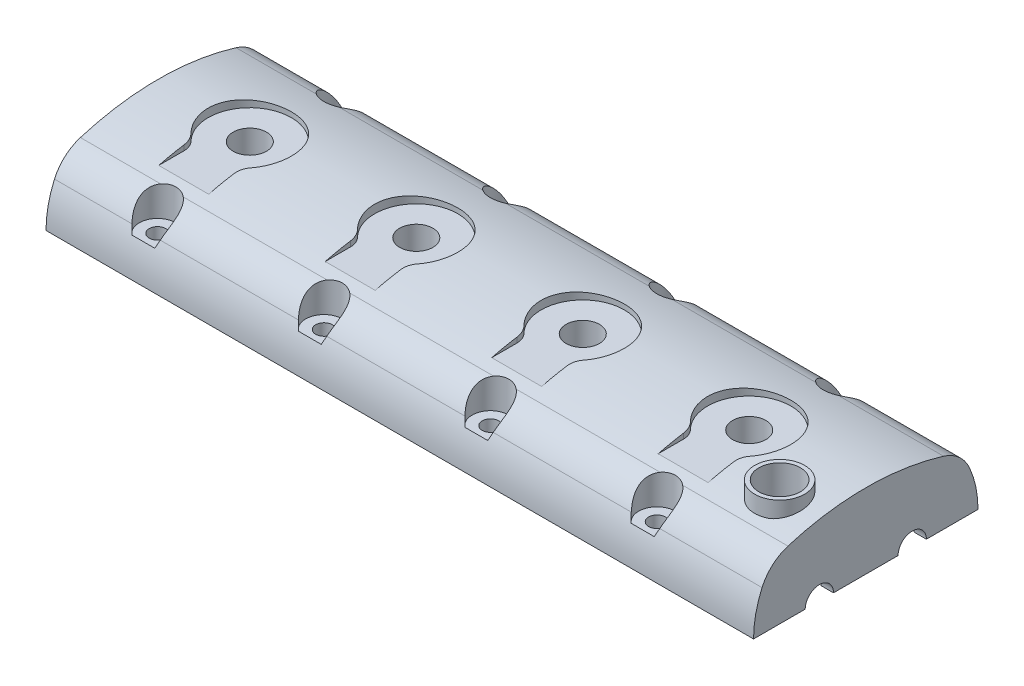
from build123d import *

# Parameters (mm, degrees)
BOSS_EXTRUDE1_DEPTH      = 212.5
BOSS_EXTRUDE1_DEPTH_BACK = 212.5
SHELL1_T                 = -7.5
BOSS_EXTRUDE2_REACH      = 229.432
SKETCH2_R                = 12
BOSS_EXTRUDE4_REACH      = 229.432
SKETCH12_R               = 12
BOSS_EXTRUDE5_DEPTH      = 212
BOSS_EXTRUDE5_DEPTH_BACK = 212
SKETCH3_R                = 11
CUT_EXTRUDE1_DEPTH       = 225.332611468
F_10_0MM_DOWEL_HOLE3_D   = 10
SKETCH18_R               = 12.5
SKETCH18_R_2             = 10
BOSS_EXTRUDE6_DEPTH      = 30
SKETCH19_R               = 10
CUT_EXTRUDE3_DEPTH       = 228.431573519
SKETCH20_W               = 7.5
SKETCH20_H               = 119.816476268
BOSS_EXTRUDE7_DEPTH      = 30
BOSS_EXTRUDE7_2_DEPTH    = 30
BOSS_EXTRUDE7_3_DEPTH    = 30
SPLIT1_START             = 88.75
SPLIT1_DEPTH             = 7.5
SPLIT1_START_2           = -11.25
SPLIT1_2_DEPTH           = 7.5
SPLIT1_START_3           = -111.25
SPLIT1_3_DEPTH           = 7.5
CUT_EXTRUDE2_DEPTH       = 228.431573519
CUT_EXTRUDE2_DEPTH_BACK  = 228.431573519
SKETCH16_R               = 8.5
CUT_EXTRUDE4_DEPTH       = 227.49529936
SKETCH22_R               = 15
BOSS_EXTRUDE8_DEPTH      = 10
CUT_EXTRUDE5_DEPTH       = 229.473457177
CUT_EXTRUDE5_DEPTH_BACK  = 229.473457177
SKETCH23_R               = 12.5


# Read off the part's stored shape, not the designer's step: Split1
with BuildPart() as part:
    # Sketch1 → Boss-Extrude1 (new, two sides: drawn at the far end of the back side and taken through both)
    with BuildSketch(Plane(origin=(0, 0, 0), x_dir=(0, 0, -1), z_dir=(1, 0, 0)).offset(-BOSS_EXTRUDE1_DEPTH_BACK)):
        with BuildLine():
            Line((-67.408238134, 0), (67.408238134, 0))
            ThreePointArc((67.408238134, 0), (66.121281258, 12.360362739), (62.315619233, 24.190483684))
            ThreePointArc((62.315619233, 24.190483684), (56.03712161, 32.804804676), (46.740792622, 38.020581312))
            ThreePointArc((46.740792622, 38.020581312), (0, 45), (-46.740792622, 38.020581312))
            ThreePointArc((-46.740792622, 38.020581312), (-56.03712161, 32.804804676), (-62.315619233, 24.190483684))
            ThreePointArc((-62.315619233, 24.190483684), (-66.121281258, 12.360362739), (-67.408238134, 0))
        make_face()
    extrude(amount=BOSS_EXTRUDE1_DEPTH + BOSS_EXTRUDE1_DEPTH_BACK)

    # Shell1
    shell1_openings = [part.faces().sort_by_distance(p)[0] for p in [
        (0, 0, 0),
    ]]
    offset(amount=SHELL1_T, openings=shell1_openings, kind=Kind.INTERSECTION)

    # Sketch2 → Boss-Extrude2 (add, up to next)
    with BuildSketch(Plane(origin=(0, 0, 0), x_dir=(1, 0, 0), z_dir=(0, 1, 0)), mode=Mode.PRIVATE) as boss_extrude2_sk1:
        with Locations((-157.5, -55.408238134)):
            Circle(SKETCH2_R)
    boss_extrude2_tool1 = extrude(boss_extrude2_sk1.sketch, amount=BOSS_EXTRUDE2_REACH, mode=Mode.PRIVATE) - part.part
    # Sketch2 → Boss-Extrude2 (add, up to next)
    with BuildSketch(Plane(origin=(0, 0, 0), x_dir=(1, 0, 0), z_dir=(0, 1, 0)), mode=Mode.PRIVATE) as boss_extrude2_sk2:
        with Locations((-57.5, -55.408238134)):
            Circle(SKETCH2_R)
    boss_extrude2_tool2 = extrude(boss_extrude2_sk2.sketch, amount=BOSS_EXTRUDE2_REACH, mode=Mode.PRIVATE) - part.part
    # Sketch2 → Boss-Extrude2 (add, up to next)
    with BuildSketch(Plane(origin=(0, 0, 0), x_dir=(1, 0, 0), z_dir=(0, 1, 0)), mode=Mode.PRIVATE) as boss_extrude2_sk3:
        with Locations((42.5, -55.408238134)):
            Circle(SKETCH2_R)
    boss_extrude2_tool3 = extrude(boss_extrude2_sk3.sketch, amount=BOSS_EXTRUDE2_REACH, mode=Mode.PRIVATE) - part.part
    # Sketch2 → Boss-Extrude2 (add, up to next)
    with BuildSketch(Plane(origin=(0, 0, 0), x_dir=(1, 0, 0), z_dir=(0, 1, 0)), mode=Mode.PRIVATE) as boss_extrude2_sk4:
        with Locations((142.5, -55.408238134)):
            Circle(SKETCH2_R)
    boss_extrude2_tool4 = extrude(boss_extrude2_sk4.sketch, amount=BOSS_EXTRUDE2_REACH, mode=Mode.PRIVATE) - part.part
    add(boss_extrude2_tool1.solids().sort_by_distance((-157.5, 0, 55.408238))[0])
    add(boss_extrude2_tool2.solids().sort_by_distance((-57.5, 0, 55.408238))[0])
    add(boss_extrude2_tool3.solids().sort_by_distance((42.5, 0, 55.408238))[0])
    add(boss_extrude2_tool4.solids().sort_by_distance((142.5, 0, 55.408238))[0])

    # Sketch12 → Boss-Extrude4 (add, up to next)
    with BuildSketch(Plane.XZ, mode=Mode.PRIVATE) as boss_extrude4_sk1:
        with Locations((-157.5, -55.408238134)):
            Circle(SKETCH12_R)
    boss_extrude4_tool1 = extrude(boss_extrude4_sk1.sketch, amount=-BOSS_EXTRUDE4_REACH, mode=Mode.PRIVATE) - part.part
    # Sketch12 → Boss-Extrude4 (add, up to next)
    with BuildSketch(Plane.XZ, mode=Mode.PRIVATE) as boss_extrude4_sk2:
        with Locations((-57.5, -55.408238134)):
            Circle(SKETCH12_R)
    boss_extrude4_tool2 = extrude(boss_extrude4_sk2.sketch, amount=-BOSS_EXTRUDE4_REACH, mode=Mode.PRIVATE) - part.part
    # Sketch12 → Boss-Extrude4 (add, up to next)
    with BuildSketch(Plane.XZ, mode=Mode.PRIVATE) as boss_extrude4_sk3:
        with Locations((42.5, -55.408238134)):
            Circle(SKETCH12_R)
    boss_extrude4_tool3 = extrude(boss_extrude4_sk3.sketch, amount=-BOSS_EXTRUDE4_REACH, mode=Mode.PRIVATE) - part.part
    # Sketch12 → Boss-Extrude4 (add, up to next)
    with BuildSketch(Plane.XZ, mode=Mode.PRIVATE) as boss_extrude4_sk4:
        with Locations((142.5, -55.408238134)):
            Circle(SKETCH12_R)
    boss_extrude4_tool4 = extrude(boss_extrude4_sk4.sketch, amount=-BOSS_EXTRUDE4_REACH, mode=Mode.PRIVATE) - part.part
    add(boss_extrude4_tool1.solids().sort_by_distance((-157.5, 0, -55.408238))[0])
    add(boss_extrude4_tool2.solids().sort_by_distance((-57.5, 0, -55.408238))[0])
    add(boss_extrude4_tool3.solids().sort_by_distance((42.5, 0, -55.408238))[0])
    add(boss_extrude4_tool4.solids().sort_by_distance((142.5, 0, -55.408238))[0])

    # Sketch17 → Boss-Extrude5 (add, two sides: drawn at the far end of the back side and taken through both)
    with BuildSketch(Plane(origin=(0, 0, 0), x_dir=(0, 0, -1), z_dir=(1, 0, 0)).offset(-BOSS_EXTRUDE5_DEPTH_BACK)):
        Polygon((-44.408238134, 36.314981565), (-52.528779147, 30), (52.528779147, 30), (44.408238134, 36.314981565), (0, 42.549434784), align=None)
    extrude(amount=BOSS_EXTRUDE5_DEPTH + BOSS_EXTRUDE5_DEPTH_BACK)

    # Sketch3 → Cut-Extrude1 (cut, through all)
    with BuildSketch(Plane(origin=(0, 20, 0), x_dir=(1, 0, 0), z_dir=(0, 1, 0))):
        with Locations((142.5, -55.408238134)):
            Circle(SKETCH3_R)
        with Locations((-157.5, -55.408238134)):
            Circle(SKETCH3_R)
        with Locations((-57.5, -55.408238134)):
            Circle(SKETCH3_R)
        with Locations((42.5, -55.408238134)):
            Circle(SKETCH3_R)
        with Locations((42.5, 55.408238134)):
            Circle(SKETCH3_R)
        with Locations((-57.5, 55.408238134)):
            Circle(SKETCH3_R)
        with Locations((-157.5, 55.408238134)):
            Circle(SKETCH3_R)
        with Locations((142.5, 55.408238134)):
            Circle(SKETCH3_R)
    extrude(amount=CUT_EXTRUDE1_DEPTH, mode=Mode.SUBTRACT)

    # Ø10.0mm Dowel Hole3 (through all)
    with Locations(Plane(origin=(0, 0, 0), x_dir=(-1, 0, 0), z_dir=(0, -1, 0))):
        with Locations((157.5, -55.408238134), (57.5, -55.408238134), (-42.5, -55.408238134), (-142.5, -55.408238134), (-142.5, 55.408238134), (-42.5, 55.408238134), (57.5, 55.408238134), (157.5, 55.408238134)):
            Hole(F_10_0MM_DOWEL_HOLE3_D / 2)

    # Sketch18 → Boss-Extrude6 (add)
    # profile 1 of 4: a face of its own
    with BuildSketch(Plane(origin=(0, 0, 0), x_dir=(1, 0, 0), z_dir=(0, 1, 0))):
        with Locations(Location((-157.5, 0, 0), (0, 0, 90))):
            Circle(SKETCH18_R)
        with Locations(Location((-157.5, 0, 0), (0, 0, 90))):
            Circle(SKETCH18_R_2, mode=Mode.SUBTRACT)
    # profile 2 of 4: a face of its own
    with BuildSketch(Plane(origin=(0, 0, 0), x_dir=(1, 0, 0), z_dir=(0, 1, 0))):
        with Locations(Location((-57.5, 0, 0), (0, 0, 90))):
            Circle(SKETCH18_R)
        with Locations(Location((-57.5, 0, 0), (0, 0, 90))):
            Circle(SKETCH18_R_2, mode=Mode.SUBTRACT)
    # profile 3 of 4: a face of its own
    with BuildSketch(Plane(origin=(0, 0, 0), x_dir=(1, 0, 0), z_dir=(0, 1, 0))):
        with Locations(Location((42.5, 0, 0), (0, 0, 90))):
            Circle(SKETCH18_R)
        with Locations(Location((42.5, 0, 0), (0, 0, 90))):
            Circle(SKETCH18_R_2, mode=Mode.SUBTRACT)
    # profile 4 of 4: a face of its own
    with BuildSketch(Plane(origin=(0, 0, 0), x_dir=(1, 0, 0), z_dir=(0, 1, 0))):
        with Locations(Location((142.5, 0, 0), (0, 0, 90))):
            Circle(SKETCH18_R)
        with Locations(Location((142.5, 0, 0), (0, 0, 90))):
            Circle(SKETCH18_R_2, mode=Mode.SUBTRACT)
    extrude(amount=BOSS_EXTRUDE6_DEPTH)

    # Sketch19 → Cut-Extrude3 (cut, through all)
    with BuildSketch(Plane(origin=(0, 0, 0), x_dir=(1, 0, 0), z_dir=(0, 1, 0))):
        with Locations((-157.5, 0)):
            Circle(SKETCH19_R)
        with Locations((-57.5, 0)):
            Circle(SKETCH19_R)
        with Locations((42.5, 0)):
            Circle(SKETCH19_R)
        with Locations((142.5, 0)):
            Circle(SKETCH19_R)
    extrude(amount=CUT_EXTRUDE3_DEPTH, mode=Mode.SUBTRACT)


with BuildPart() as body_2:
    # Sketch20 → Boss-Extrude7 (new body)
    with BuildSketch(Plane(origin=(0, 0, 0), x_dir=(1, 0, 0), z_dir=(0, 1, 0))):
        with Locations((-107.5, 0)):
            Rectangle(SKETCH20_W, SKETCH20_H)
    extrude(amount=BOSS_EXTRUDE7_DEPTH)

    # Split1 3 outline → Split1 3 (cut)
    with BuildSketch(Plane.YZ.offset(SPLIT1_START_3)):
        with BuildLine():
            Line((30, -59.908238134), (30, -58.738925818))
            ThreePointArc((30, -58.738925818), (29.242348026, -59.338443294), (28.462097067, -59.908238134))
            Line((28.462097067, -59.908238134), (30, -59.908238134))
        make_face()
        with BuildLine():
            ThreePointArc((28.462097067, 59.908238134), (29.242348026, 59.338443294), (30, 58.738925818))
            Line((30, 58.738925818), (30, 59.908238134))
            Line((30, 59.908238134), (28.462097067, 59.908238134))
        make_face()
    extrude(amount=SPLIT1_3_DEPTH, mode=Mode.SUBTRACT)


with BuildPart() as body_3:
    # Sketch20 → Boss-Extrude7 2 (new body)
    with BuildSketch(Plane(origin=(0, 0, 0), x_dir=(1, 0, 0), z_dir=(0, 1, 0))):
        with Locations((-7.5, 0)):
            Rectangle(SKETCH20_W, SKETCH20_H)
    extrude(amount=BOSS_EXTRUDE7_2_DEPTH)

    # Split1 2 outline → Split1 2 (cut)
    with BuildSketch(Plane.YZ.offset(SPLIT1_START_2)):
        with BuildLine():
            Line((30, -59.908238134), (30, -58.738925818))
            ThreePointArc((30, -58.738925818), (29.242348026, -59.338443294), (28.462097067, -59.908238134))
            Line((28.462097067, -59.908238134), (30, -59.908238134))
        make_face()
        with BuildLine():
            ThreePointArc((28.462097067, 59.908238134), (29.242348026, 59.338443294), (30, 58.738925818))
            Line((30, 58.738925818), (30, 59.908238134))
            Line((30, 59.908238134), (28.462097067, 59.908238134))
        make_face()
    extrude(amount=SPLIT1_2_DEPTH, mode=Mode.SUBTRACT)


with BuildPart() as body_4:
    # Sketch20 → Boss-Extrude7 3 (new body)
    with BuildSketch(Plane(origin=(0, 0, 0), x_dir=(1, 0, 0), z_dir=(0, 1, 0))):
        with Locations((92.5, 0)):
            Rectangle(SKETCH20_W, SKETCH20_H)
    extrude(amount=BOSS_EXTRUDE7_3_DEPTH)

    # Split1 outline → Split1 (cut)
    with BuildSketch(Plane.YZ.offset(SPLIT1_START)):
        with BuildLine():
            Line((30, -59.908238134), (30, -58.738925818))
            ThreePointArc((30, -58.738925818), (29.242348026, -59.338443294), (28.462097067, -59.908238134))
            Line((28.462097067, -59.908238134), (30, -59.908238134))
        make_face()
        with BuildLine():
            ThreePointArc((28.462097067, 59.908238134), (29.242348026, 59.338443294), (30, 58.738925818))
            Line((30, 58.738925818), (30, 59.908238134))
            Line((30, 59.908238134), (28.462097067, 59.908238134))
        make_face()
    extrude(amount=SPLIT1_DEPTH, mode=Mode.SUBTRACT)


with BuildPart() as part_1:
    add(part.part)

    # Combine1: union body 2, body 3, body 4
    add(body_2.part)
    add(body_3.part)
    add(body_4.part)

    # Sketch16 → Cut-Extrude2 (cut, two sides: drawn at the far end of the back side and taken through both)
    with BuildSketch(Plane(origin=(0, 0, 0), x_dir=(0, 0, -1), z_dir=(1, 0, 0)).offset(-CUT_EXTRUDE2_DEPTH_BACK)):
        with Locations((27.896972929, 0)):
            Circle(SKETCH16_R)
        with Locations((-27.896972929, 0)):
            Circle(SKETCH16_R)
    extrude(amount=CUT_EXTRUDE2_DEPTH + CUT_EXTRUDE2_DEPTH_BACK, mode=Mode.SUBTRACT)

    # Sketch21 → Cut-Extrude4 (cut, through all)
    with BuildSketch(Plane(origin=(0, 40, 0), x_dir=(1, 0, 0), z_dir=(0, 1, 0))):
        with BuildLine():
            Line((-172.5, -24.494897428), (-172.5, -45))
            Line((-172.5, -45), (-142.5, -45))
            Line((-142.5, -45), (-142.5, -24.494897428))
            ThreePointArc((-142.5, -24.494897428), (-141.758200998, -20.715252698), (-139.642857143, -17.496355306))
            ThreePointArc((-139.642857143, -17.496355306), (-157.5, 25), (-175.357142857, -17.496355306))
            ThreePointArc((-175.357142857, -17.496355306), (-173.241799002, -20.715252698), (-172.5, -24.494897428))
        make_face()
        with BuildLine():
            Line((-72.5, -24.494897428), (-72.5, -45))
            Line((-72.5, -45), (-42.5, -45))
            Line((-42.5, -45), (-42.5, -24.494897428))
            ThreePointArc((-42.5, -24.494897428), (-41.758200998, -20.715252698), (-39.642857143, -17.496355306))
            ThreePointArc((-39.642857143, -17.496355306), (-57.5, 25), (-75.357142857, -17.496355306))
            ThreePointArc((-75.357142857, -17.496355306), (-73.241799002, -20.715252698), (-72.5, -24.494897428))
        make_face()
        with BuildLine():
            Line((27.5, -24.494897428), (27.5, -45))
            Line((27.5, -45), (57.5, -45))
            Line((57.5, -45), (57.5, -24.494897428))
            ThreePointArc((57.5, -24.494897428), (58.241799002, -20.715252698), (60.357142857, -17.496355306))
            ThreePointArc((60.357142857, -17.496355306), (42.5, 25), (24.642857143, -17.496355306))
            ThreePointArc((24.642857143, -17.496355306), (26.758200998, -20.715252698), (27.5, -24.494897428))
        make_face()
        with BuildLine():
            Line((127.5, -24.494897428), (127.5, -45))
            Line((127.5, -45), (157.5, -45))
            Line((157.5, -45), (157.5, -24.494897428))
            ThreePointArc((157.5, -24.494897428), (158.241799002, -20.715252698), (160.357142857, -17.496355306))
            ThreePointArc((160.357142857, -17.496355306), (142.5, 25), (124.642857143, -17.496355306))
            ThreePointArc((124.642857143, -17.496355306), (126.758200998, -20.715252698), (127.5, -24.494897428))
        make_face()
    extrude(amount=CUT_EXTRUDE4_DEPTH, mode=Mode.SUBTRACT)

    # Sketch22 → Boss-Extrude8 (add)
    with BuildSketch(Plane(origin=(0, 40, 0), x_dir=(1, 0, 0), z_dir=(0, 1, 0))):
        with Locations(Location((187.5, -26.740792622, 0), (0, 0, 239.658717093))):
            Circle(SKETCH22_R)
    extrude(amount=BOSS_EXTRUDE8_DEPTH)

    # Sketch23 → Cut-Extrude5 (cut, two sides: drawn at the far end of the back side and taken through both)
    with BuildSketch(Plane(origin=(0, 50, 0), x_dir=(1, 0, 0), z_dir=(0, 1, 0)).offset(-CUT_EXTRUDE5_DEPTH_BACK)):
        with Locations(Location((187.5, -26.740792622, 0), (0, 0, 270))):
            Circle(SKETCH23_R)
    extrude(amount=CUT_EXTRUDE5_DEPTH + CUT_EXTRUDE5_DEPTH_BACK, mode=Mode.SUBTRACT)


solid = part_1.part
